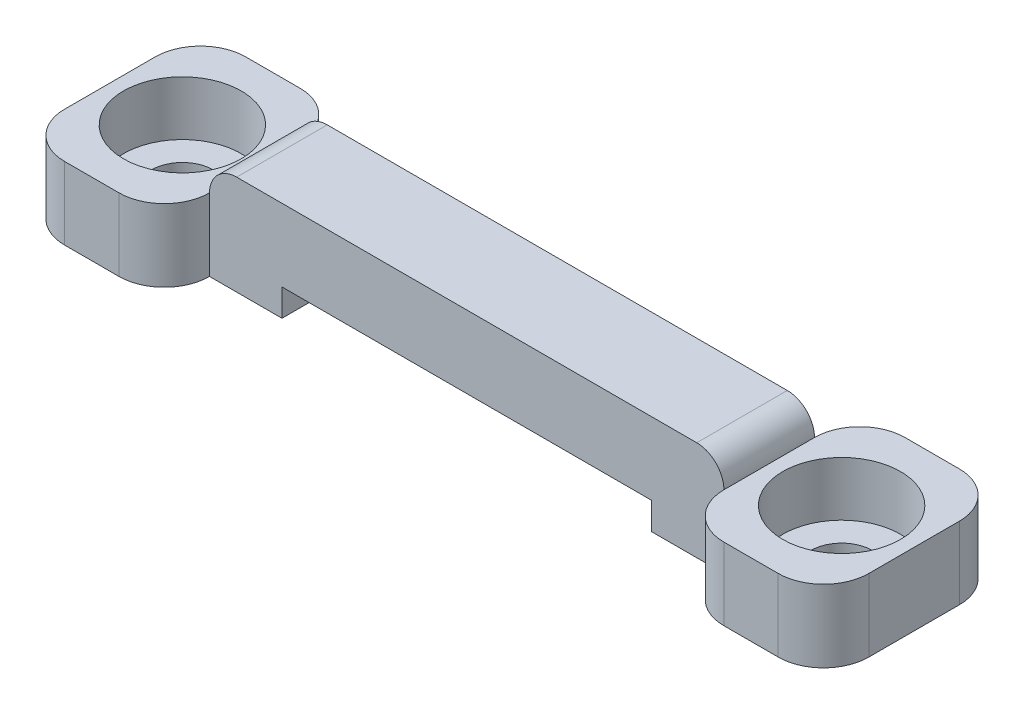
from build123d import *

# Parameters (mm, degrees)
RESSALTO_EXTRUS_O1_DEPTH          = 10
REBAIXO_PARA_SHCS_M31_D           = 3.4
REBAIXO_PARA_SHCS_M31_CBORE_D     = 6.5
REBAIXO_PARA_SHCS_M31_CBORE_DEPTH = 3
ESBO_O4_W                         = 28.4
ESBO_O4_H                         = 5.5
CORTE_EXTRUS_O1_DEPTH             = 2.5
ESBO_O5_W                         = 28.4
ESBO_O5_H                         = 5.5
CORTE_EXTRUS_O2_DEPTH             = 2.5
FILETE1_R                         = 2.5
FILETE2_R                         = 1.5


with BuildPart() as part:
    # Esboço1 → Ressalto-extrusão1 (new body)
    with BuildSketch(Plane.XY):
        Polygon((0, 0), (12, 0), (12, 1.5), (32.4, 1.5), (32.4, 0), (44.4, 0), (44.4, 4), (36.4, 4), (36.4, 5.5), (8, 5.5), (8, 4), (0, 4), align=None)
    extrude(amount=RESSALTO_EXTRUS_O1_DEPTH)

    # Rebaixo para SHCS M31 (through all)
    with Locations(Plane(origin=(0, 4, 0), x_dir=(1, 0, 0), z_dir=(0, 1, 0))):
        with Locations((4, -5), (40.4, -5)):
            CounterBoreHole(REBAIXO_PARA_SHCS_M31_D / 2, REBAIXO_PARA_SHCS_M31_CBORE_D / 2, REBAIXO_PARA_SHCS_M31_CBORE_DEPTH)

    # Esboço4 → Corte-extrusão1 (cut)
    with BuildSketch(Plane.XY.offset(10)):
        with Locations((22.2, 2.75)):
            Rectangle(ESBO_O4_W, ESBO_O4_H)
    extrude(amount=-CORTE_EXTRUS_O1_DEPTH, mode=Mode.SUBTRACT)

    # Esboço5 → Corte-extrusão2 (cut)
    with BuildSketch(Plane(origin=(0, 0, 0), x_dir=(-1, 0, 0), z_dir=(0, 0, -1))):
        with Locations((-22.2, 2.75)):
            Rectangle(ESBO_O5_W, ESBO_O5_H)
    extrude(amount=-CORTE_EXTRUS_O2_DEPTH, mode=Mode.SUBTRACT)

    # Filete1
    filete1_edges = [part.edges().sort_by_distance(p)[0] for p in [
        (8, 2, 10),
        (0, 2, 10),
        (0, 2, 0),
        (8, 2, 0),
        (36.4, 2, 10),
        (44.4, 2, 10),
        (44.4, 2, 0),
        (36.4, 2, 0),
    ]]
    fillet(filete1_edges, radius=FILETE1_R - 0.0001)  # a hair under: the kernel refuses the full size

    # Filete2
    filete2_edges = [part.edges().sort_by_distance(p)[0] for p in [
        (36.4, 5.5, 5),
        (8, 5.5, 5),
    ]]
    fillet(filete2_edges, radius=FILETE2_R - 0.0001)  # a hair under: the kernel refuses the full size


solid = part.part
